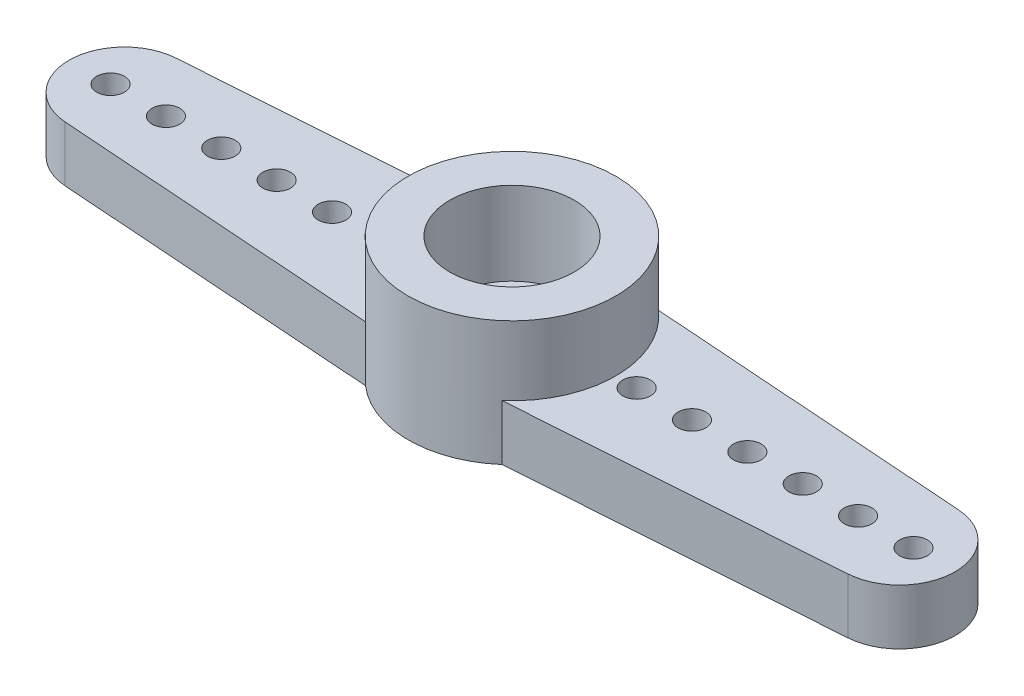
from build123d import *

# Parameters (mm, degrees)
BOSS_EXTRUDE1_DEPTH = 2
SKETCH5_R           = 0.5
CUT_EXTRUDE5_DEPTH  = 3
LPATTERN1_COUNT     = 6
LPATTERN1_PITCH     = 2
MIRROR2_OUTLINE_R   = 0.5
MIRROR2_DEPTH       = 2
SKETCH2_R           = 3.75
BOSS_EXTRUDE2_DEPTH = 4.5
SKETCH3_R           = 2.25
CUT_EXTRUDE1_DEPTH  = 3
SKETCH4_R           = 1.4
CUT_EXTRUDE2_DEPTH  = 3


# Read off the part's stored shape, not the designer's step: Mirror2
with BuildPart() as part:
    # Sketch1 → Boss-Extrude1 (new body)
    with BuildSketch(Plane(origin=(0, 0, 0), x_dir=(1, 0, 0), z_dir=(0, 1, 0))):
        with BuildLine():
            Line((0, 3), (14.136480176, 2))
            ThreePointArc((14.136480176, 2), (15.461917194, 1.366812545), (16, 0))
            Line((16, 0), (0, 0))
            Line((0, 0), (0, 3))
        make_face()
    boss_extrude1 = extrude(amount=BOSS_EXTRUDE1_DEPTH)

    # Mirror1: Boss-Extrude1 across plane
    add(boss_extrude1.mirror(Plane.XY))

    # Sketch5 → Cut-Extrude5 (cut)
    with BuildSketch(Plane(origin=(0, 0, 0), x_dir=(1, 0, 0), z_dir=(0, 1, 0))):
        with Locations(Location((4.5, 0, 0), (0, 0, 90))):
            Circle(SKETCH5_R)
    cut_extrude5 = extrude(amount=CUT_EXTRUDE5_DEPTH, mode=Mode.SUBTRACT)

    # LPattern1: Cut-Extrude5 ×6
    with Locations(*[(i * LPATTERN1_PITCH, 0, 0) for i in range(1, LPATTERN1_COUNT)]):
        add(cut_extrude5, mode=Mode.SUBTRACT)

    # Mirror2 outline → Mirror2 (add)
    with BuildSketch(Plane(origin=(0, 0, 0), x_dir=(1, 0, 0), z_dir=(0, 1, 0))):
        with BuildLine():
            Line((0, -3), (0, 3))
            Line((0, 3), (-14.136480176, 2))
            ThreePointArc((-14.136480176, 2), (-16, 0), (-14.136480176, -2))
            Line((-14.136480176, -2), (0, -3))
        make_face()
        with Locations((-14.5, 0)):
            Circle(MIRROR2_OUTLINE_R, mode=Mode.SUBTRACT)
        with Locations((-12.5, 0)):
            Circle(MIRROR2_OUTLINE_R, mode=Mode.SUBTRACT)
        with Locations((-10.5, 0)):
            Circle(MIRROR2_OUTLINE_R, mode=Mode.SUBTRACT)
        with Locations((-8.5, 0)):
            Circle(MIRROR2_OUTLINE_R, mode=Mode.SUBTRACT)
        with Locations((-6.5, 0)):
            Circle(MIRROR2_OUTLINE_R, mode=Mode.SUBTRACT)
        with Locations((-4.5, 0)):
            Circle(MIRROR2_OUTLINE_R, mode=Mode.SUBTRACT)
    extrude(amount=MIRROR2_DEPTH)

    # Sketch2 → Boss-Extrude2 (add)
    with BuildSketch(Plane(origin=(0, 0, 0), x_dir=(1, 0, 0), z_dir=(0, 1, 0))):
        with Locations(Location((0, 0, 0), (0, 0, 48.893793678))):
            Circle(SKETCH2_R)
    extrude(amount=BOSS_EXTRUDE2_DEPTH)

    # Sketch3 → Cut-Extrude1 (cut)
    with BuildSketch(Plane(origin=(0, 4.5, 0), x_dir=(1, 0, 0), z_dir=(0, 1, 0))):
        with Locations(Location((0, 0, 0), (0, 0, 270))):
            Circle(SKETCH3_R)
    extrude(amount=-CUT_EXTRUDE1_DEPTH, mode=Mode.SUBTRACT)

    # Sketch4 → Cut-Extrude2 (cut)
    with BuildSketch(Plane(origin=(0, 1.5, 0), x_dir=(1, 0, 0), z_dir=(0, 1, 0))):
        with Locations(Location((0, 0, 0), (0, 0, 270))):
            Circle(SKETCH4_R)
    extrude(amount=-CUT_EXTRUDE2_DEPTH, mode=Mode.SUBTRACT)


solid = part.part
